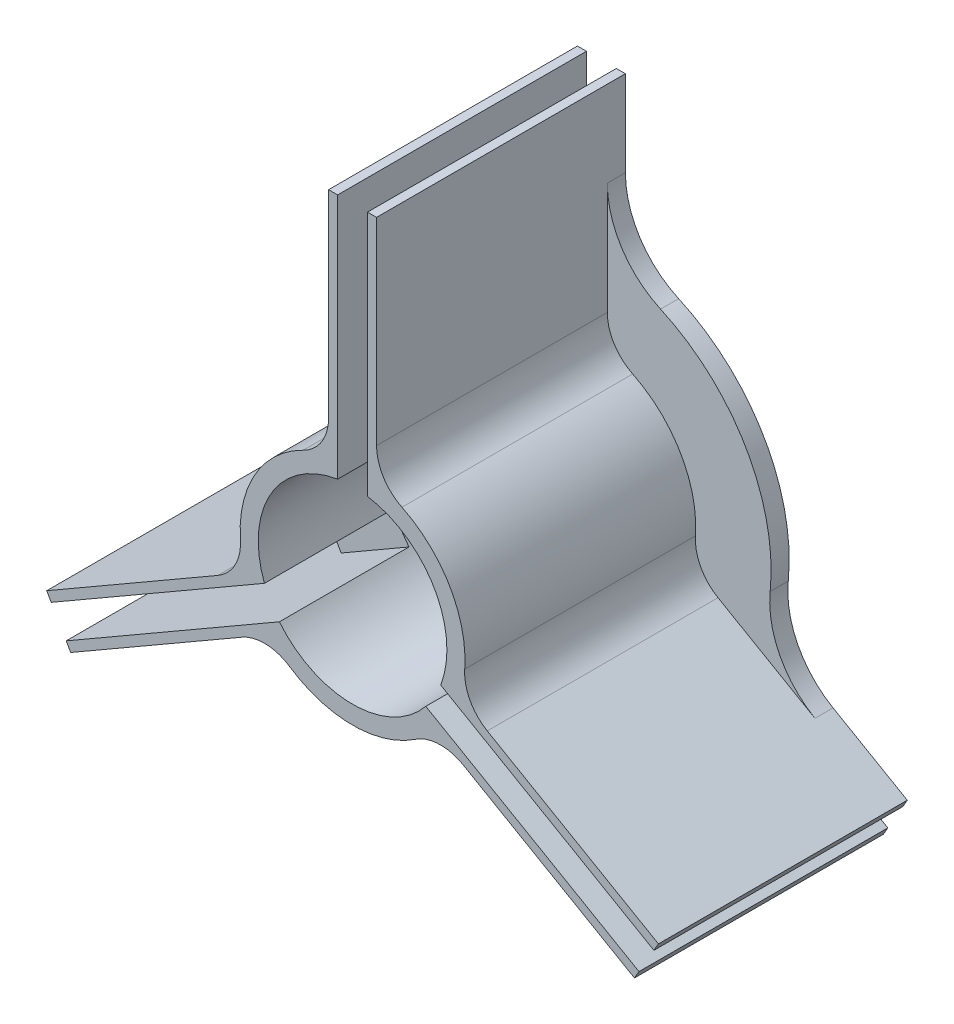
from build123d import *

# Parameters (mm, degrees)
SKETCH1_R                       = 20.75
BOSS_EXTRUDE1_DEPTH             = 100
BOSS_EXTRUDE2_DEPTH             = 3.2
THICKEN1_OUTLINE_R              = 24.85
THICKEN1_OUTLINE_R_2            = 20.85
THICKEN1_DEPTH                  = 100
THICKEN2_START                  = 26.35
THICKEN2_DEPTH                  = 73.65
THICKEN2_2_OUTLINE_W            = 2
THICKEN2_2_OUTLINE_H            = 37
THICKEN2_2_DEPTH                = 26.35
THICKEN3_START                  = 26.35
THICKEN3_DEPTH                  = 73.65
THICKEN3_2_OUTLINE_W            = 2
THICKEN3_2_OUTLINE_H            = 37
THICKEN3_2_DEPTH                = 26.35
BOSS_EXTRUDE4_REACH             = 129.446
SKETCH4_W                       = 26.35
SKETCH4_H                       = 17.15
BOSS_EXTRUDE4_DIRECTION_2_REACH = 129.446
FILLET1_R                       = 10
SKETCH3_R                       = 41.5
BOSS_EXTRUDE3_DEPTH             = 4
FILLET2_R                       = 20
CIRPATTERN4_COUNT               = 3
MOVE_FACE3_BY                   = 0.1
MOVE_FACE4_BY                   = 0.1
MOVE_FACE4_2_BY                 = 0.1
MOVE_FACE4_3_BY                 = 0.1
MOVE_START                      = 26.35
MOVE_FACE5_OUTLINE_W            = 6.6
MOVE_FACE5_OUTLINE_H            = 20.75
MOVE_FACE5_DEPTH                = 73.65
CIRPATTERN1_COUNT               = 3
SKETCH5_R                       = 108.755446709
CUT_EXTRUDE1_DEPTH              = 45


with BuildPart() as part:
    # Sketch1 → Boss-Extrude1 (new body)
    with BuildSketch(Plane.XY):
        Circle(SKETCH1_R)
    extrude(amount=BOSS_EXTRUDE1_DEPTH)

    # Move Face3: a curved face moved outward by 0.1
    add(Solid.thicken(part.faces().sort_by_distance((-20.75, 0, 50))[0], MOVE_FACE3_BY))


with BuildPart() as body_2:
    # Sketch2 → Boss-Extrude2 (new, symmetric)
    with BuildSketch(Plane(origin=(0, 0, 0), x_dir=(0, 0, -1), z_dir=(1, 0, 0))):
        Polygon((-26.35, 20.75), (-26.35, 38), (0, 38), (0, 75), (-100, 75), (-100, 20.75), align=None)
    extrude(amount=BOSS_EXTRUDE2_DEPTH, both=True)

    # Move Face4: a face moved outward by 0.1
    extrude(body_2.faces().sort_by_distance((0, 38, 13.175))[0], amount=MOVE_FACE4_BY, dir=(0, -1, 0))

    # Move Face4 2: a face moved outward by 0.1
    extrude(body_2.faces().sort_by_distance((-3.2, 49.566782958, 53.367562563))[0], amount=MOVE_FACE4_2_BY, dir=(-1, 0, 0))

    # Move Face4 3: a face moved outward by 0.1
    extrude(body_2.faces().sort_by_distance((3.2, 49.566782958, 53.367562563))[0], amount=MOVE_FACE4_3_BY, dir=(1, 0, 0))

    # Move Face5: read off the stored shape, not the designer's step
    # Move Face5 outline → Move Face5 (add)
    with BuildSketch(Plane.XY.offset(MOVE_START)):
        with Locations((0, 10.375)):
            Rectangle(MOVE_FACE5_OUTLINE_W, MOVE_FACE5_OUTLINE_H)
    extrude(amount=MOVE_FACE5_DEPTH)


with BuildPart() as body_3:
    # Thicken1: read off the stored shape, not the designer's step
    # Thicken1 outline → Thicken1 (new body)
    with BuildSketch(Plane.XY):
        Circle(THICKEN1_OUTLINE_R)
        Circle(THICKEN1_OUTLINE_R_2, mode=Mode.SUBTRACT)
    extrude(amount=THICKEN1_DEPTH)

    # Thicken2: read off the stored shape, not the designer's step
    # Thicken2 outline → Thicken2 (add)
    with BuildSketch(Plane.XY.offset(THICKEN2_START)):
        with BuildLine():
            ThreePointArc((-5.3, 24.27823099), (-4.303593806, 24.474508787), (-3.3, 24.629910678))
            Line((-3.3, 24.629910678), (-3.3, 75))
            Line((-3.3, 75), (-5.3, 75))
            Line((-5.3, 75), (-5.3, 24.27823099))
        make_face()
    extrude(amount=THICKEN2_DEPTH)

    # Thicken2 2 outline → Thicken2 2 (add)
    with BuildSketch(Plane.XY):
        with Locations((-4.3, 56.5)):
            Rectangle(THICKEN2_2_OUTLINE_W, THICKEN2_2_OUTLINE_H)
    extrude(amount=THICKEN2_2_DEPTH)

    # Thicken3: read off the stored shape, not the designer's step
    # Thicken3 outline → Thicken3 (add)
    with BuildSketch(Plane.XY.offset(THICKEN3_START)):
        with BuildLine():
            Line((3.3, 75), (3.3, 24.629910678))
            ThreePointArc((3.3, 24.629910678), (4.303593806, 24.474508787), (5.3, 24.27823099))
            Line((5.3, 24.27823099), (5.3, 75))
            Line((5.3, 75), (3.3, 75))
        make_face()
    extrude(amount=THICKEN3_DEPTH)

    # Thicken3 2 outline → Thicken3 2 (add)
    with BuildSketch(Plane.XY):
        with Locations((4.3, 56.5)):
            Rectangle(THICKEN3_2_OUTLINE_W, THICKEN3_2_OUTLINE_H)
    extrude(amount=THICKEN3_2_DEPTH)

    # Boss-Extrude4: up to this face of the body (flat: up to its plane)
    boss_extrude4_end = Plane(body_3.part.faces().sort_by_distance((5.3, 51.059106065, 52.826548797))[0])
    # Sketch4 → Boss-Extrude4 (add, up to the picked face)
    with BuildSketch(Plane(origin=(0, 0, 0), x_dir=(0, 0, -1), z_dir=(1, 0, 0)), mode=Mode.PRIVATE) as boss_extrude4_sk1:
        with Locations((-13.175, 29.425)):
            Rectangle(SKETCH4_W, SKETCH4_H)
    boss_extrude4_tool1 = split(extrude(boss_extrude4_sk1.sketch, amount=BOSS_EXTRUDE4_REACH, mode=Mode.PRIVATE), bisect_by=boss_extrude4_end, keep=Keep.BOTH, mode=Mode.PRIVATE)
    add(boss_extrude4_tool1.solids().sort_by(Axis((0, 29.425, 13.175), (1, 0, 0)))[0])

    # Boss-Extrude4 direction 2: up to this face of the body (flat: up to its plane)
    boss_extrude4_direction_2_end = Plane(body_3.part.faces().sort_by_distance((-5.3, 51.059106065, 52.826548797))[0])
    # Sketch4 → Boss-Extrude4 direction 2 (add, up to the picked face)
    with BuildSketch(Plane(origin=(0, 0, 0), x_dir=(0, 0, -1), z_dir=(1, 0, 0)), mode=Mode.PRIVATE) as boss_extrude4_direction_2_sk1:
        with Locations((-13.175, 29.425)):
            Rectangle(SKETCH4_W, SKETCH4_H)
    boss_extrude4_direction_2_tool1 = split(extrude(boss_extrude4_direction_2_sk1.sketch, amount=-BOSS_EXTRUDE4_DIRECTION_2_REACH, mode=Mode.PRIVATE), bisect_by=boss_extrude4_direction_2_end, keep=Keep.BOTH, mode=Mode.PRIVATE)
    add(boss_extrude4_direction_2_tool1.solids().sort_by(Axis((0, 29.425, 13.175), (-1, 0, 0)))[0])

    # Fillet1
    fillet1_edges = [body_3.edges().sort_by_distance(p)[0] for p in [
        (-5.3, 24.27823099, 50),
        (5.3, 24.27823099, 50),
    ]]
    fillet(fillet1_edges, radius=FILLET1_R)

    # Sketch3 → Boss-Extrude3 (add)
    with BuildSketch(Plane.XY):
        Circle(SKETCH3_R)
    extrude(amount=BOSS_EXTRUDE3_DEPTH)

    # Fillet2
    fillet2_edges = [body_3.edges().sort_by_distance(p)[0] for p in [
        (-5.3, 41.160174927, 2),
        (5.3, 41.160174927, 2),
    ]]
    fillet(fillet2_edges, radius=FILLET2_R)


with BuildPart() as cirpattern4_1:
    # CirPattern4: pattern copy
    add(body_3.part.rotate(Axis((0, 0, 0), (0, 0, 1)), 1 * 360 / CIRPATTERN4_COUNT))


with BuildPart() as cirpattern4_2:
    # CirPattern4: pattern copy
    add(body_3.part.rotate(Axis((0, 0, 0), (0, 0, 1)), 2 * 360 / CIRPATTERN4_COUNT))

    # Combine2: read off the stored shape, not the designer's step
    # Combine2: union CirPattern4_1, body 3
    add(cirpattern4_1.part)
    add(body_3.part)


with BuildPart() as cirpattern1_1:
    # CirPattern1: pattern copy
    add(body_2.part.rotate(Axis((0, 0, 0), (0, 0, 1)), 1 * 360 / CIRPATTERN1_COUNT))


with BuildPart() as cirpattern1_2:
    # CirPattern1: pattern copy
    add(body_2.part.rotate(Axis((0, 0, 0), (0, 0, 1)), 2 * 360 / CIRPATTERN1_COUNT))


with BuildPart() as cirpattern4_2_1:
    add(cirpattern4_2.part)

    # Combine3: read off the stored shape, not the designer's step
    # Combine3: cut CirPattern1_2, CirPattern1_1, body 2, part
    add(cirpattern1_2.part, mode=Mode.SUBTRACT)
    add(cirpattern1_1.part, mode=Mode.SUBTRACT)
    add(body_2.part, mode=Mode.SUBTRACT)
    add(part.part, mode=Mode.SUBTRACT)

    # Sketch5 → Cut-Extrude1 (cut)
    with BuildSketch(Plane.XY.offset(100)):
        Circle(SKETCH5_R)
    extrude(amount=-CUT_EXTRUDE1_DEPTH, mode=Mode.SUBTRACT)


solid = cirpattern4_2_1.part
